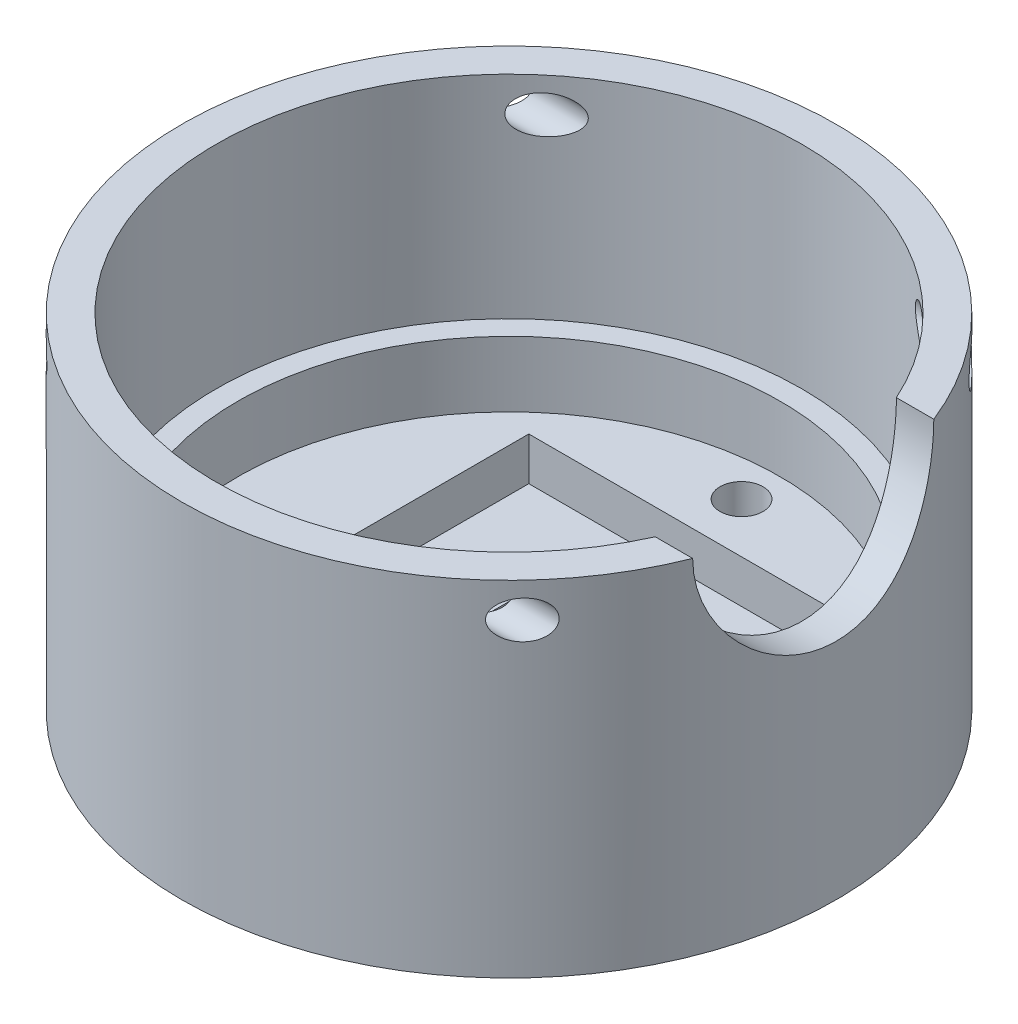
from build123d import *

# Parameters (mm, degrees)
SKETCH3_R                            = 19
MAIN_BODY_DEPTH                      = 20
CUT_START                            = -7.7
SKETCH5_R                            = 17
CUT_FOR_HEADERS_DEPTH                = 26.796268449
CUT_FOR_ADNS_WIRES_REACH             = 35.496
SKETCH7_R                            = 7
SKETCH8_R                            = 15.75
CUT_FOR_PCB_DEPTH                    = 3.8
SKETCH9_R                            = 1.25
CUT_FOR_SCREW_HOLES_DEPTH            = 5
SKETCH10_W                           = 18.9
SKETCH10_H                           = 21.2
CUT_FOR_LENS_DEPTH                   = 2.5
CUT_FOR_PUPIL_REACH                  = 34.68
SKETCH11_W                           = 8.2
SKETCH11_H                           = 10.2
CUTS_FOR_BODY_SCREW_HOLES_DEPTH      = 34.496268622
CUTS_FOR_BODY_SCREW_HOLES_DEPTH_BACK = 34.496268622
SKETCH13_R                           = 1.1


with BuildPart() as part:
    # Sketch3 → Main Body (new body)
    with BuildSketch(Plane(origin=(0, 0, 0), x_dir=(1, 0, 0), z_dir=(0, 1, 0))):
        Circle(SKETCH3_R)
    extrude(amount=-MAIN_BODY_DEPTH)

    # Sketch5 → Cut for Headers (cut, through all)
    with BuildSketch(Plane.XZ.offset(20).offset(CUT_START)):
        Circle(SKETCH5_R)
    extrude(amount=-CUT_FOR_HEADERS_DEPTH, mode=Mode.SUBTRACT)

    # Sketch7 → Cut for ADNS Wires (cut, up to next)
    with BuildSketch(Plane(origin=(0, 0, 0), x_dir=(0, 0, -1), z_dir=(1, 0, 0)), mode=Mode.PRIVATE) as cut_for_adns_wires_sk1:
        Circle(SKETCH7_R)
    cut_for_adns_wires_tool1 = extrude(cut_for_adns_wires_sk1.sketch, amount=CUT_FOR_ADNS_WIRES_REACH, mode=Mode.PRIVATE) & part.part
    add(cut_for_adns_wires_tool1.solids().sort_by_distance((0, 0, 0))[0], mode=Mode.SUBTRACT)

    # Sketch8 → Cut for PCB (cut)
    with BuildSketch(Plane(origin=(0, -12.3, 0), x_dir=(1, 0, 0), z_dir=(0, 1, 0))):
        Circle(SKETCH8_R)
    extrude(amount=-CUT_FOR_PCB_DEPTH, mode=Mode.SUBTRACT)

    # Sketch9 → Cut for Screw Holes (cut)
    with BuildSketch(Plane(origin=(0, -16.1, 0), x_dir=(1, 0, 0), z_dir=(0, 1, 0))):
        with Locations((0, 13.5)):
            Circle(SKETCH9_R)
        with Locations((0, -13.5)):
            Circle(SKETCH9_R)
    extrude(amount=-CUT_FOR_SCREW_HOLES_DEPTH, mode=Mode.SUBTRACT)

    # Sketch10 → Cut for Lens (cut)
    with BuildSketch(Plane(origin=(0, -16.1, 0), x_dir=(1, 0, 0), z_dir=(0, 1, 0))):
        Rectangle(SKETCH10_W, SKETCH10_H)
    extrude(amount=-CUT_FOR_LENS_DEPTH, mode=Mode.SUBTRACT)

    # Sketch11 → Cut for Pupil (cut, up to next)
    with BuildSketch(Plane(origin=(0, -18.6, 0), x_dir=(1, 0, 0), z_dir=(0, 1, 0)), mode=Mode.PRIVATE) as cut_for_pupil_sk1:
        Rectangle(SKETCH11_W, SKETCH11_H)
    cut_for_pupil_tool1 = extrude(cut_for_pupil_sk1.sketch, amount=-CUT_FOR_PUPIL_REACH, mode=Mode.PRIVATE) & part.part
    add(cut_for_pupil_tool1.solids().sort_by_distance((0, -18.6, 0))[0], mode=Mode.SUBTRACT)

    # Sketch13 → Cuts for Body Screw Holes (cut, two sides: drawn at the far end of the back side and taken through both)
    with BuildSketch(Plane(origin=(0, 0, 0), x_dir=(0, 0, -1), z_dir=(1, 0, 0)).offset(-CUTS_FOR_BODY_SCREW_HOLES_DEPTH_BACK)):
        with Locations((13, -2)):
            Circle(SKETCH13_R)
        with Locations((-13, -2)):
            Circle(SKETCH13_R)
    extrude(amount=CUTS_FOR_BODY_SCREW_HOLES_DEPTH + CUTS_FOR_BODY_SCREW_HOLES_DEPTH_BACK, mode=Mode.SUBTRACT)


solid = part.part
